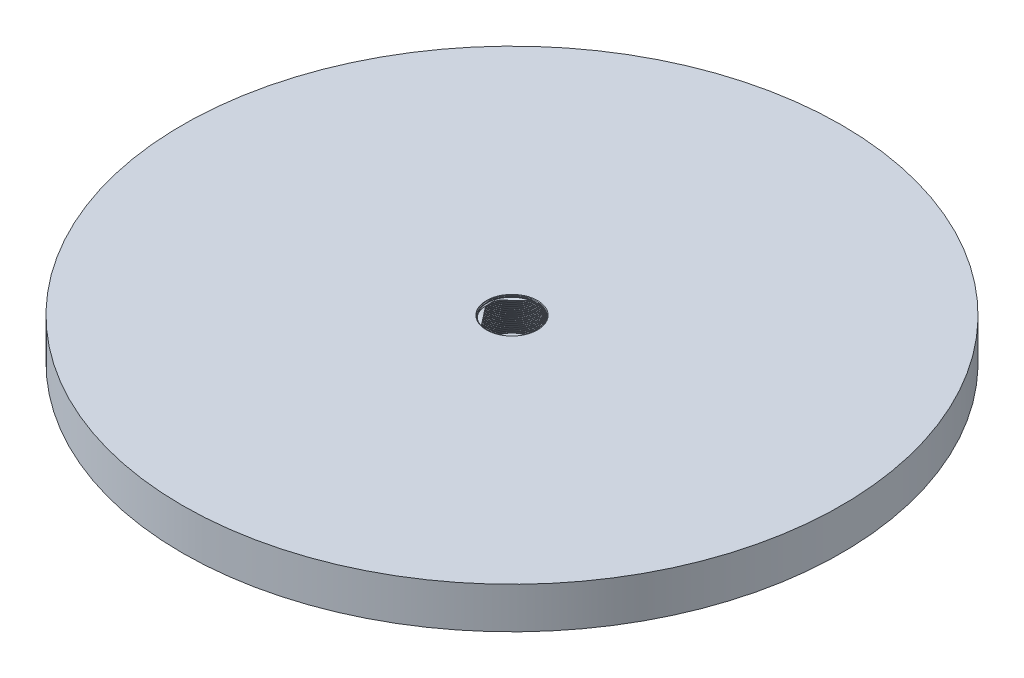
from build123d import *

# Parameters (mm, degrees)
SKETCH1_R           = 400
BOSS_EXTRUDE1_DEPTH = 25
SKETCH2_R           = 30
CUT_EXTRUDE1_DEPTH  = 40
CHAMFER1_SIZE       = 1
THREAD1_PITCH       = 2


with BuildPart() as part:
    # Sketch1 → Boss-Extrude1 (new, symmetric)
    with BuildSketch(Plane(origin=(0, 0, 0), x_dir=(1, 0, 0), z_dir=(0, 1, 0))):
        with Locations(Location((0, 0, 0), (0, 0, 270))):
            Circle(SKETCH1_R)
    extrude(amount=BOSS_EXTRUDE1_DEPTH, both=True)

    # Sketch2 → Cut-Extrude1 (cut)
    with BuildSketch(Plane(origin=(0, 25, 0), x_dir=(1, 0, 0), z_dir=(0, 1, 0))):
        with Locations(Location((0, 0, 0), (0, 0, 270))):
            Circle(SKETCH2_R)
    extrude(amount=-CUT_EXTRUDE1_DEPTH, mode=Mode.SUBTRACT)

    # Chamfer1
    chamfer1_edges = [part.edges().sort_by_distance(p)[0] for p in [
        (0, 25, -30),
    ]]
    chamfer(chamfer1_edges, length=CHAMFER1_SIZE)

    # Thread1: the profile of Thread Profile1 profile screwed along a right-hand helix of 22 turns, 10 arcs to a turn; built about Z, then put on its axis
    thread1_z = Axis((0, 0, 0), (0, 0, 1))
    thread1_corners = [(29.9997, 0, -0.000173205), (30.811898813, 0, 0.468749998), (30.811898813, 0, 0.656249998), (29.9997, 0, 1.125173201)]
    with BuildLine(mode=Mode.PRIVATE) as thread1_profile:
        Line(thread1_corners[0], thread1_corners[1])
        Line(thread1_corners[1], thread1_corners[2])
        Line(thread1_corners[2], thread1_corners[3])
        Line(thread1_corners[3], thread1_corners[0])
    thread1_cap = Face(thread1_profile.wire())
    thread1_turn_angles = [0, 18, 36, 54, 72, 90, 108, 126, 144, 162, 180, 198, 216, 234, 252, 270, 288, 306, 324, 342, 360]
    thread1_turn_weights = [1, 0.9510565162951535, 1, 0.9510565162951535, 1, 0.9510565162951535, 1, 0.9510565162951535, 1, 0.9510565162951535, 1, 0.9510565162951535, 1, 0.9510565162951535, 1, 0.9510565162951535, 1, 0.9510565162951535, 1, 0.9510565162951535, 1]
    thread1_turn_rails = [Edge.make_bspline([Vector(p[0], p[1], 0).rotate(thread1_z, thread1_turn_angles[k]) / thread1_turn_weights[k] + Vector(0, 0, p[2] + THREAD1_PITCH * thread1_turn_angles[k] / 360) for k in range(21)], [0, 0, 0, 1, 1, 2, 2, 3, 3, 4, 4, 5, 5, 6, 6, 7, 7, 8, 8, 9, 9, 10, 10, 10], 2, thread1_turn_weights) for p in thread1_corners]
    thread1_turn_sides = [Face.make_surface_from_curves(thread1_turn_rails[p[0]], thread1_turn_rails[p[1]]) for p in [(0, 1), (1, 2), (2, 3), (3, 0)]]
    thread1 = Plane(origin=(0, 29, 0), x_dir=(-1, 0, 0), z_dir=(0, -1, 0)) * Solid(Shell([*[p.moved(Location((0, 0, THREAD1_PITCH * i))) for i in range(22) for p in thread1_turn_sides], thread1_cap, thread1_cap.rotate(thread1_z, 7920).moved(Location((0, 0, THREAD1_PITCH * 7920 / 360)))]))
    add(thread1, mode=Mode.SUBTRACT)


solid = part.part
